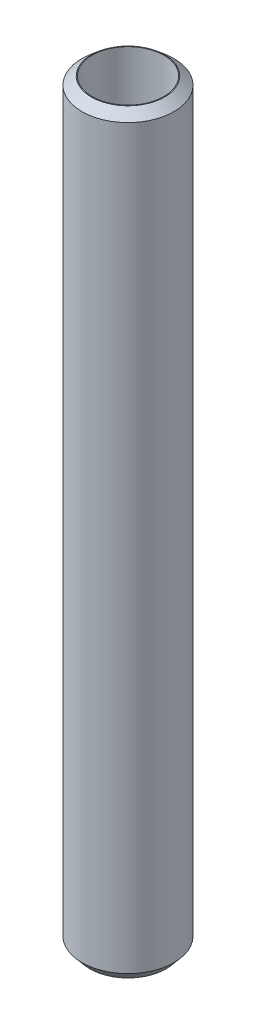
from build123d import *
from OCP.BRepFilletAPI import BRepFilletAPI_MakeChamfer

# Parameters (mm, degrees)
SKETCH1_R           = 30
BOSS_EXTRUDE1_DEPTH = 491.77262186
SKETCH2_R           = 23.375056594
CUT_EXTRUDE1_DEPTH  = 494.599343204
CHAMFER1_SIZE       = 5.170345731
CHAMFER1_SIZE2      = 6.115501207


with BuildPart() as part:
    # Sketch1 → Boss-Extrude1 (new body)
    with BuildSketch(Plane(origin=(0, 0, 0), x_dir=(1, 0, 0), z_dir=(0, 1, 0))):
        Circle(SKETCH1_R)
    extrude(amount=BOSS_EXTRUDE1_DEPTH)

    # Sketch2 → Cut-Extrude1 (cut, through all)
    with BuildSketch(Plane(origin=(0, 0, 0), x_dir=(1, 0, 0), z_dir=(0, 1, 0))):
        Circle(SKETCH2_R)
    extrude(amount=CUT_EXTRUDE1_DEPTH, mode=Mode.SUBTRACT)

    # Chamfer1: one chamfer whose edges measure the first distance from different faces: ONE call of the kernel's chamfer builder (chamfer() names one face for all edges)
    chamfer1_edges_1 = [part.edges().sort_by_distance(p)[0] for p in [
        (-30, 491.77262186, 0),
    ]]
    chamfer1_side_1 = [part.faces().sort_by_distance(p)[0] for p in [
        (-30, 245.88631093, 0),
    ]]
    chamfer1_edges_2 = [part.edges().sort_by_distance(p)[0] for p in [
        (-30, 0, 0),
    ]]
    chamfer1_side_2 = [part.faces().sort_by_distance(p)[0] for p in [
        (-29.151471863, 0, 0),
    ]]
    chamfer1 = BRepFilletAPI_MakeChamfer(part.part.solid().wrapped)
    for e in chamfer1_edges_1:
        chamfer1.Add(CHAMFER1_SIZE, CHAMFER1_SIZE2, e.wrapped, chamfer1_side_1[0].wrapped)  # the first distance lies on this face
    for e in chamfer1_edges_2:
        chamfer1.Add(CHAMFER1_SIZE, CHAMFER1_SIZE2, e.wrapped, chamfer1_side_2[0].wrapped)  # the first distance lies on this face
    add(Compound.cast(chamfer1.Shape()), mode=Mode.REPLACE)


solid = part.part
